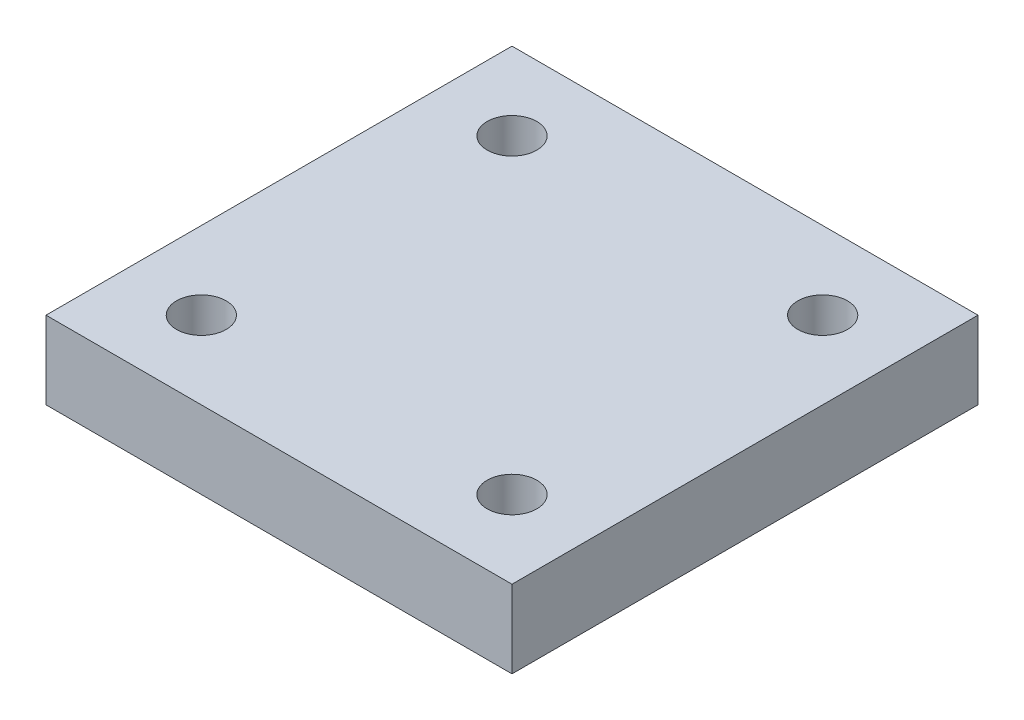
from build123d import *

# Parameters (mm, degrees)
SKETCH1_W           = 30
SKETCH1_H           = 30
SKETCH1_R           = 1.6
BOSS_EXTRUDE1_DEPTH = 5


with BuildPart() as part:
    # Sketch1 → Boss-Extrude1 (new body)
    with BuildSketch(Plane(origin=(0, 0, 0), x_dir=(1, 0, 0), z_dir=(0, 1, 0))):
        Rectangle(SKETCH1_W, SKETCH1_H)
        with Locations((-10, 10)):
            Circle(SKETCH1_R, mode=Mode.SUBTRACT)
        with Locations((10, 10)):
            Circle(SKETCH1_R, mode=Mode.SUBTRACT)
        with Locations((10, -10)):
            Circle(SKETCH1_R, mode=Mode.SUBTRACT)
        with Locations((-10, -10)):
            Circle(SKETCH1_R, mode=Mode.SUBTRACT)
    extrude(amount=BOSS_EXTRUDE1_DEPTH)


solid = part.part
